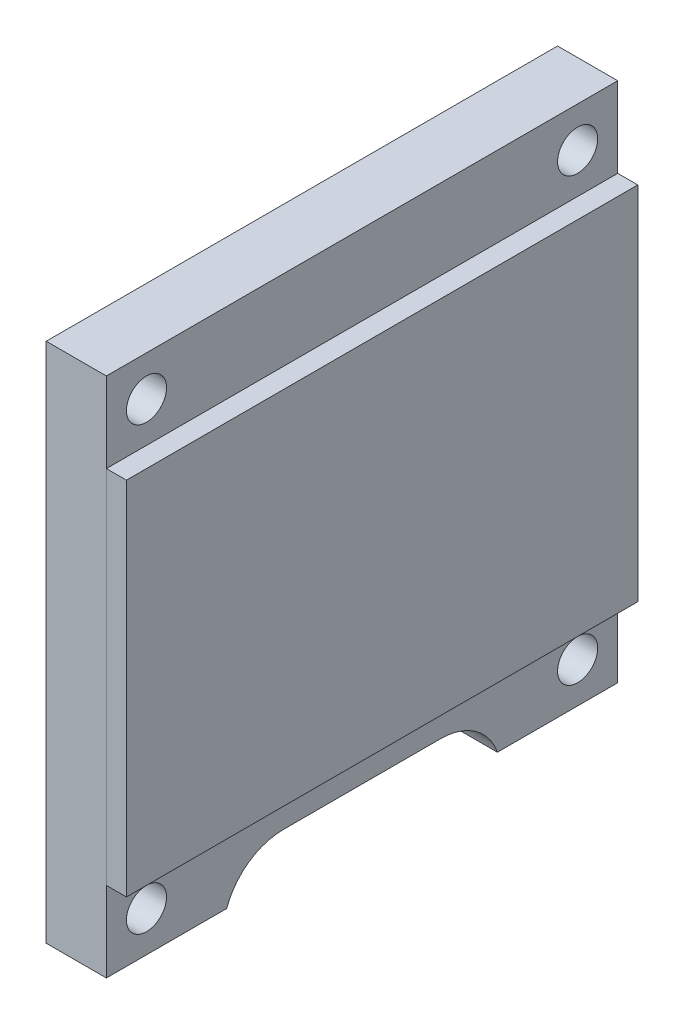
from build123d import *

# Parameters (mm, degrees)
SKETCH_1_R      = 1
EXTRUDE_1_DEPTH = 3
FILLET_1_R      = 3
SKETCH_2_W      = 25.5
SKETCH_2_H      = 18
EXTRUDE_2_DEPTH = 1


with BuildPart() as part:
    # 草图1 → 凸台-拉伸1 (new body)
    with BuildSketch(Plane(origin=(0, 0, 0), x_dir=(0, 0, -1), z_dir=(1, 0, 0))):
        Polygon((-12.75, -13), (-6.75, -13), (-6.75, -11), (6.75, -11), (6.75, -13), (12.75, -13), (12.75, 13), (-12.75, 13), align=None)
        with Locations((-10.75, -11)):
            Circle(SKETCH_1_R, mode=Mode.SUBTRACT)
        with Locations((-10.75, 11)):
            Circle(SKETCH_1_R, mode=Mode.SUBTRACT)
        with Locations((10.75, 11)):
            Circle(SKETCH_1_R, mode=Mode.SUBTRACT)
        with Locations((10.75, -11)):
            Circle(SKETCH_1_R, mode=Mode.SUBTRACT)
    extrude(amount=EXTRUDE_1_DEPTH)

    # 圆角1
    # the kernel refuses this fillet: 3 mm, written as the material it adds along each edge
    with BuildSketch(Plane(origin=(0, -11, 6.75), x_dir=(0, -1, 0), z_dir=(1, 0, 0))) as fillet_1_piece_1:
        with BuildLine():
            CenterArc((3, 2.828427125), FILLET_1_R, 180, 70.528779366)
            Line((0, 2.828427125), (-0.06, 2.828427125))
            Line((-0.06, 2.828427125), (-0.06, 0))
            Line((-0.06, 0), (0, -0.06))
            ThreePointArc((0, -0.06), (1, -0.06), (1.98, -0.056568542))
            Line((1.98, -0.056568542), (2, 0))
        make_face()
    extrude(amount=3)
    with BuildSketch(Plane(origin=(0, -11, -6.75), x_dir=(0, 0, 1), z_dir=(1, 0, 0))) as fillet_1_piece_2:
        with BuildLine():
            CenterArc((2.828427125, 3), FILLET_1_R, 199.471220634, 70.528779366)
            Line((0, 2), (-0.056568542, 1.98))
            ThreePointArc((-0.056568542, 1.98), (-0.06, 1), (-0.06, 0))
            Line((-0.06, 0), (0, -0.06))
            Line((0, -0.06), (2.828427125, -0.06))
            Line((2.828427125, -0.06), (2.828427125, 0))
        make_face()
    extrude(amount=3)


with BuildPart() as body_2:
    # 草图2 → 凸台-拉伸2 (new body)
    with BuildSketch(Plane(origin=(3, 0, 0), x_dir=(0, 0, -1), z_dir=(1, 0, 0))):
        Rectangle(SKETCH_2_W, SKETCH_2_H)
    extrude(amount=EXTRUDE_2_DEPTH)


solid = Compound([part.part, body_2.part])
